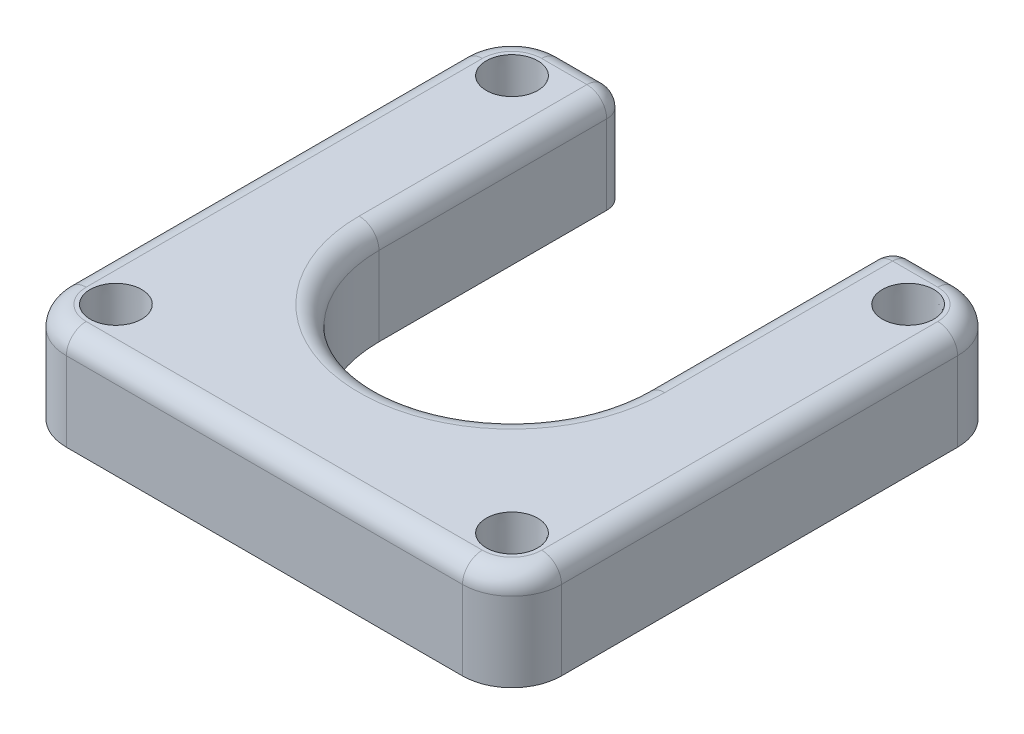
from build123d import *

# Parameters (mm, degrees)
BOSS_EXTRUDE1_DEPTH          = 10
SKETCH1_4_R                  = 1.7
CUT_EXTRUDE1_DEPTH           = 37.742346142
CUT_EXTRUDE2_START           = 10
SKETCH1_5_R                  = 2.6
CUT_EXTRUDE2_DEPTH           = 3.9
CUT_EXTRUDE2_DRAFT           = -1.5
CUT_EXTRUDE2_PROFILE_2_DEPTH = 3.9
CUT_EXTRUDE2_PROFILE_2_DRAFT = -1.5
CUT_EXTRUDE2_PROFILE_3_DEPTH = 3.9
CUT_EXTRUDE2_PROFILE_3_DRAFT = -1.5
CUT_EXTRUDE2_PROFILE_4_DEPTH = 3.9
CUT_EXTRUDE2_PROFILE_4_DRAFT = -1.5
FILLET1_R                    = 2
FILLET2_R                    = 2


with BuildPart() as part:
    # Sketch1 → Boss-Extrude1 (new body)
    with BuildSketch(Plane(origin=(0, 0, 0), x_dir=(1, 0, 0), z_dir=(0, 1, 0))):
        with BuildLine():
            Line((-20, -25), (20, -25))
            ThreePointArc((20, -25), (23.535533906, -23.535533906), (25, -20))
            Line((25, -20), (25, 20))
            ThreePointArc((25, 20), (23.535533906, 23.535533906), (20, 25))
            Line((20, 25), (-20, 25))
            ThreePointArc((-20, 25), (-23.535533906, 23.535533906), (-25, 20))
            Line((-25, 20), (-25, -20))
            ThreePointArc((-25, -20), (-23.535533906, -23.535533906), (-20, -25))
        make_face()
    extrude(amount=BOSS_EXTRUDE1_DEPTH)

    # Sketch1<4> → Cut-Extrude1 (cut, through all)
    with BuildSketch(Plane(origin=(0, 0, 0), x_dir=(1, 0, 0), z_dir=(0, 1, 0))):
        with BuildLine():
            Line((13.435, 25), (-13.435, 25))
            Line((-13.435, 25), (-13.435, 0))
            ThreePointArc((-13.435, 0), (0, -13.435), (13.435, 0))
            Line((13.435, 0), (13.435, 25))
        make_face()
        with Locations(Location((-20, 20, 0), (0, 0, 270))):
            Circle(SKETCH1_4_R)
        with Locations(Location((-20, -20, 0), (0, 0, 90))):
            Circle(SKETCH1_4_R)
        with Locations(Location((20, -20, 0), (0, 0, 90))):
            Circle(SKETCH1_4_R)
        with Locations(Location((20, 20, 0), (0, 0, 270))):
            Circle(SKETCH1_4_R)
    extrude(amount=CUT_EXTRUDE1_DEPTH, mode=Mode.SUBTRACT)


with BuildPart() as cut_extrude2_tool:
    # Sketch1<5> → Cut-Extrude2 (with draft: the straight prism first)
    with BuildSketch(Plane(origin=(0, 0, 0), x_dir=(1, 0, 0), z_dir=(0, 1, 0)).offset(CUT_EXTRUDE2_START)):
        with Locations((-20, 20)):
            Circle(SKETCH1_5_R)
    extrude(amount=-CUT_EXTRUDE2_DEPTH)
    # Cut-Extrude2: the draft: its side faces are tilted about the plane it starts from
    cut_extrude2_sides = [cut_extrude2_tool.faces().sort_by_distance(p)[0] for p in [
        (-22.6, 8.05, -20),
    ]]
    draft(cut_extrude2_sides, Plane(origin=(0, 0, 0), x_dir=(1, 0, 0), z_dir=(0, 1, 0)).offset(CUT_EXTRUDE2_START), CUT_EXTRUDE2_DRAFT)


with BuildPart() as part_1:
    add(part.part)

    # Cut-Extrude2: cut by cut_extrude2_tool
    add(cut_extrude2_tool.part, mode=Mode.SUBTRACT)


with BuildPart() as cut_extrude2_profile_2_tool:
    # Sketch1<5> → Cut-Extrude2 profile 2 (with draft: the straight prism first)
    with BuildSketch(Plane(origin=(0, 0, 0), x_dir=(1, 0, 0), z_dir=(0, 1, 0)).offset(CUT_EXTRUDE2_START)):
        with Locations((20, 20)):
            Circle(SKETCH1_5_R)
    extrude(amount=-CUT_EXTRUDE2_PROFILE_2_DEPTH)
    # Cut-Extrude2 profile 2: the draft: its side faces are tilted about the plane it starts from
    cut_extrude2_profile_2_sides = [cut_extrude2_profile_2_tool.faces().sort_by_distance(p)[0] for p in [
        (17.4, 8.05, -20),
    ]]
    draft(cut_extrude2_profile_2_sides, Plane(origin=(0, 0, 0), x_dir=(1, 0, 0), z_dir=(0, 1, 0)).offset(CUT_EXTRUDE2_START), CUT_EXTRUDE2_PROFILE_2_DRAFT)


with BuildPart() as part_2:
    add(part_1.part)

    # Cut-Extrude2 profile 2: cut by cut_extrude2_profile_2_tool
    add(cut_extrude2_profile_2_tool.part, mode=Mode.SUBTRACT)


with BuildPart() as cut_extrude2_profile_3_tool:
    # Sketch1<5> → Cut-Extrude2 profile 3 (with draft: the straight prism first)
    with BuildSketch(Plane(origin=(0, 0, 0), x_dir=(1, 0, 0), z_dir=(0, 1, 0)).offset(CUT_EXTRUDE2_START)):
        with Locations((-20, -20)):
            Circle(SKETCH1_5_R)
    extrude(amount=-CUT_EXTRUDE2_PROFILE_3_DEPTH)
    # Cut-Extrude2 profile 3: the draft: its side faces are tilted about the plane it starts from
    cut_extrude2_profile_3_sides = [cut_extrude2_profile_3_tool.faces().sort_by_distance(p)[0] for p in [
        (-22.6, 8.05, 20),
    ]]
    draft(cut_extrude2_profile_3_sides, Plane(origin=(0, 0, 0), x_dir=(1, 0, 0), z_dir=(0, 1, 0)).offset(CUT_EXTRUDE2_START), CUT_EXTRUDE2_PROFILE_3_DRAFT)


with BuildPart() as part_3:
    add(part_2.part)

    # Cut-Extrude2 profile 3: cut by cut_extrude2_profile_3_tool
    add(cut_extrude2_profile_3_tool.part, mode=Mode.SUBTRACT)


with BuildPart() as cut_extrude2_profile_4_tool:
    # Sketch1<5> → Cut-Extrude2 profile 4 (with draft: the straight prism first)
    with BuildSketch(Plane(origin=(0, 0, 0), x_dir=(1, 0, 0), z_dir=(0, 1, 0)).offset(CUT_EXTRUDE2_START)):
        with Locations((20, -20)):
            Circle(SKETCH1_5_R)
    extrude(amount=-CUT_EXTRUDE2_PROFILE_4_DEPTH)
    # Cut-Extrude2 profile 4: the draft: its side faces are tilted about the plane it starts from
    cut_extrude2_profile_4_sides = [cut_extrude2_profile_4_tool.faces().sort_by_distance(p)[0] for p in [
        (17.4, 8.05, 20),
    ]]
    draft(cut_extrude2_profile_4_sides, Plane(origin=(0, 0, 0), x_dir=(1, 0, 0), z_dir=(0, 1, 0)).offset(CUT_EXTRUDE2_START), CUT_EXTRUDE2_PROFILE_4_DRAFT)


with BuildPart() as part_4:
    add(part_3.part)

    # Cut-Extrude2 profile 4: cut by cut_extrude2_profile_4_tool
    add(cut_extrude2_profile_4_tool.part, mode=Mode.SUBTRACT)

    # Fillet1
    fillet1_edges = [part_4.edges().sort_by_distance(p)[0] for p in [
        (-13.435, 10, -12.5),
        (-13.435, 5, -25),
        (13.435, 5, -25),
        (0, 10, 13.435),
        (13.435, 10, -12.5),
    ]]
    fillet(fillet1_edges, radius=FILLET1_R)

    # Fillet2
    # the kernel refuses this fillet: 2 mm, written as the material it takes off along each edge
    with BuildSketch(Plane(origin=(15.435, 8, -23), x_dir=(0, 1, 0), z_dir=(0, 0, -1))) as fillet2_piece_1_section:
        Polygon((0, 0), (FILLET2_R, 0), (FILLET2_R, -FILLET2_R), (0, -FILLET2_R), align=None)
    fillet2_piece_1 = extrude(amount=FILLET2_R, mode=Mode.PRIVATE)
    fillet2_piece_1 = fillet2_piece_1 - Plane(origin=(15.435, 8, -23), x_dir=(0.7071067811865475, -0.7071067811865475, 0), z_dir=(0, 0, -1)) * Sphere(FILLET2_R, mode=Mode.PRIVATE)
    add(fillet2_piece_1, mode=Mode.SUBTRACT)
    with BuildSketch(Plane(origin=(-15.435, 8, -23), x_dir=(0, 1, 0), z_dir=(0, 0, -1))) as fillet2_piece_2_section:
        Polygon((0, 0), (FILLET2_R, 0), (FILLET2_R, FILLET2_R), (0, FILLET2_R), align=None)
    fillet2_piece_2 = extrude(amount=FILLET2_R, mode=Mode.PRIVATE)
    fillet2_piece_2 = fillet2_piece_2 - Plane(origin=(-15.435, 8, -23), x_dir=(-0.7071067811865475, -0.7071067811865475, 0), z_dir=(0, 0, -1)) * Sphere(FILLET2_R, mode=Mode.PRIVATE)
    add(fillet2_piece_2, mode=Mode.SUBTRACT)
    with BuildSketch(Plane(origin=(-20, 10, -20), x_dir=(0, 0, -1), z_dir=(1, 0, 0))) as fillet2_piece_3:
        with BuildLine():
            CenterArc((5 - FILLET2_R, -FILLET2_R), FILLET2_R, 0, 90)
            Line((5 - FILLET2_R, 0), (5, 0))
            Line((5, 0), (5, -FILLET2_R))
        make_face()
    revolve(axis=Axis((-20, 10, -20), (0, 1, 0)), revolution_arc=90, mode=Mode.SUBTRACT)
    with BuildSketch(Plane(origin=(-15.435, 10, -25), x_dir=(0, -1, 0), z_dir=(-1, 0, 0)), Plane(origin=(20, 10, -25), x_dir=(0, -1, 0), z_dir=(-1, 0, 0))) as fillet2_piece_4:
        with BuildLine():
            CenterArc((FILLET2_R, FILLET2_R), FILLET2_R, 180, 90)
            Line((0, FILLET2_R), (0, 0))
            Line((0, 0), (FILLET2_R, 0))
        make_face()
    extrude(amount=4.565, mode=Mode.SUBTRACT)
    with BuildSketch(Plane(origin=(20, 10, -20), x_dir=(1, 0, 0), z_dir=(0, 0, 1))) as fillet2_piece_5:
        with BuildLine():
            CenterArc((5 - FILLET2_R, -FILLET2_R), FILLET2_R, 0, 90)
            Line((5 - FILLET2_R, 0), (5, 0))
            Line((5, 0), (5, -FILLET2_R))
        make_face()
    revolve(axis=Axis((20, 10, -20), (0, 1, 0)), revolution_arc=90, mode=Mode.SUBTRACT)
    with BuildSketch(Plane(origin=(25, 10, 20), x_dir=(0, -1, 0), z_dir=(0, 0, -1)), Plane(origin=(-20, 10, 25), x_dir=(0, -1, 0), z_dir=(1, 0, 0)), Plane(origin=(-25, 10, -20), x_dir=(0, -1, 0), z_dir=(0, 0, 1))) as fillet2_piece_6:
        with BuildLine():
            CenterArc((FILLET2_R, FILLET2_R), FILLET2_R, 180, 90)
            Line((0, FILLET2_R), (0, 0))
            Line((0, 0), (FILLET2_R, 0))
        make_face()
    extrude(amount=40, mode=Mode.SUBTRACT)
    with BuildSketch(Plane(origin=(20, 10, 20), x_dir=(0, 0, 1), z_dir=(-1, 0, 0))) as fillet2_piece_7:
        with BuildLine():
            CenterArc((5 - FILLET2_R, -FILLET2_R), FILLET2_R, 0, 90)
            Line((5 - FILLET2_R, 0), (5, 0))
            Line((5, 0), (5, -FILLET2_R))
        make_face()
    revolve(axis=Axis((20, 10, 20), (0, 1, 0)), revolution_arc=90, mode=Mode.SUBTRACT)
    with BuildSketch(Plane(origin=(-20, 10, 20), x_dir=(-1, 0, 0), z_dir=(0, 0, -1))) as fillet2_piece_8:
        with BuildLine():
            CenterArc((5 - FILLET2_R, -FILLET2_R), FILLET2_R, 0, 90)
            Line((5 - FILLET2_R, 0), (5, 0))
            Line((5, 0), (5, -FILLET2_R))
        make_face()
    revolve(axis=Axis((-20, 10, 20), (0, 1, 0)), revolution_arc=90, mode=Mode.SUBTRACT)


solid = part_4.part
